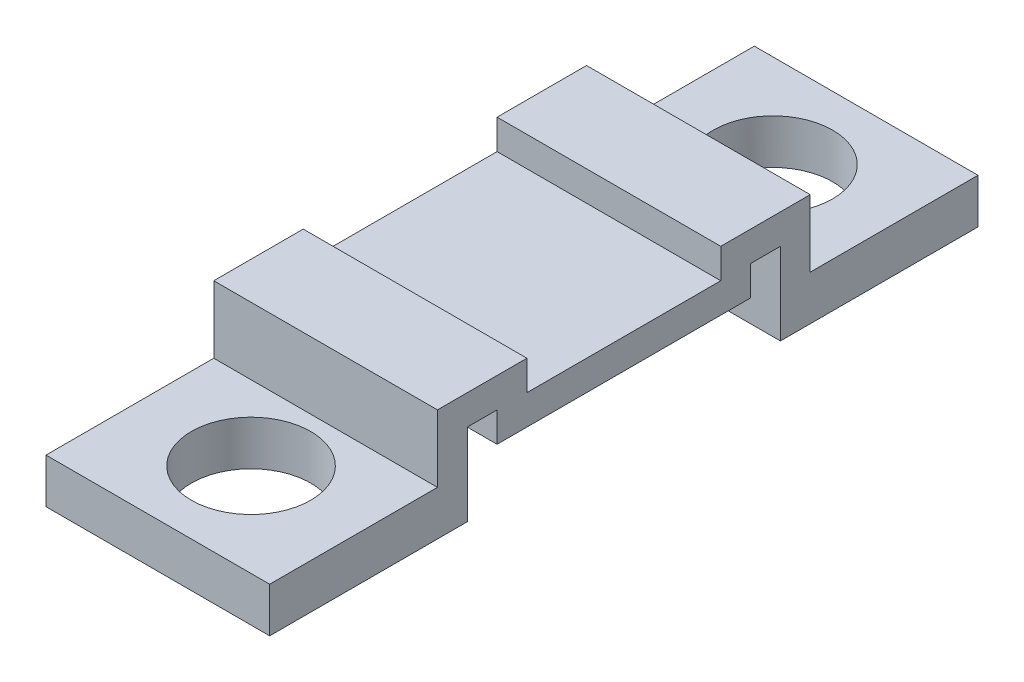
from build123d import *

# Parameters (mm, degrees)
BOSS_EXTRUDE4_DEPTH = 3
CUT_EXTRUDE1_REACH  = 12.124
SKETCH5_R           = 1.6


with BuildPart() as part:
    # Sketch4 → Boss-Extrude4 (new, symmetric)
    with BuildSketch(Plane(origin=(0, 0, 0), x_dir=(0, 0, -1), z_dir=(1, 0, 0))):
        Polygon((-5, -1), (-5, 0.8), (-2.6, 0.8), (-2.6, 0), (2.6, 0), (2.6, 0.8), (5, 0.8), (5, -1), (9.5, -1), (9.5, -2.2), (4.2, -2.2), (4.2, 0), (3.4, 0), (3.4, -0.8), (-3.4, -0.8), (-3.4, 0), (-4.2, 0), (-4.2, -2.2), (-9.5, -2.2), (-9.5, -1), align=None)
    extrude(amount=BOSS_EXTRUDE4_DEPTH, both=True)

    # Sketch5 → Cut-Extrude1 (cut, up to next)
    with BuildSketch(Plane(origin=(0, -1, 0), x_dir=(1, 0, 0), z_dir=(0, 1, 0)), mode=Mode.PRIVATE) as cut_extrude1_sk1:
        with Locations((0, -7)):
            Circle(SKETCH5_R)
    cut_extrude1_tool1 = extrude(cut_extrude1_sk1.sketch, amount=-CUT_EXTRUDE1_REACH, mode=Mode.PRIVATE) & part.part
    # Sketch5 → Cut-Extrude1 (cut, up to next)
    with BuildSketch(Plane(origin=(0, -1, 0), x_dir=(1, 0, 0), z_dir=(0, 1, 0)), mode=Mode.PRIVATE) as cut_extrude1_sk2:
        with Locations((0, 7)):
            Circle(SKETCH5_R)
    cut_extrude1_tool2 = extrude(cut_extrude1_sk2.sketch, amount=-CUT_EXTRUDE1_REACH, mode=Mode.PRIVATE) & part.part
    add(cut_extrude1_tool1.solids().sort_by_distance((0, -1, 7))[0], mode=Mode.SUBTRACT)
    add(cut_extrude1_tool2.solids().sort_by_distance((0, -1, -7))[0], mode=Mode.SUBTRACT)


solid = part.part
